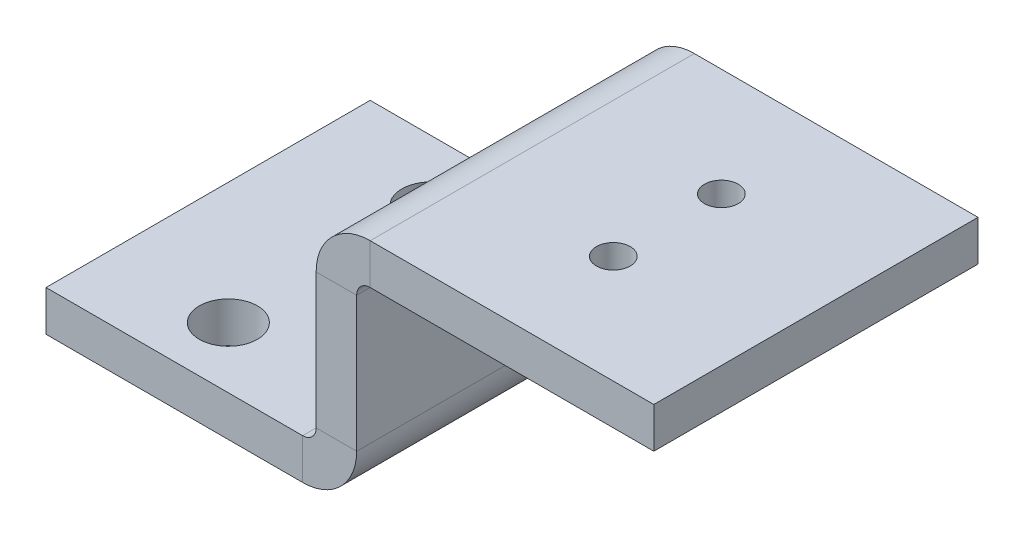
from build123d import *

# Parameters (mm, degrees)
SM_BASE_FLANGE_1_DEPTH = 24
HOLE_WIZARD_M4_1_D     = 4.3
M3X0_5_1_D             = 2.5


# Sheet-metal steps are written as plain solids
with BuildPart() as part:
    # Sketch 1 → 基材-凸緣1 (new body)
    with BuildSketch(Plane.XY):
        with BuildLine():
            Line((25, 15), (4, 15))
            ThreePointArc((4, 15), (1.171572875, 13.828427125), (0, 11))
            Line((0, 11), (0, 1))
            ThreePointArc((0, 1), (-0.292893219, 0.292893219), (-1, 0))
            Line((-1, 0), (-20, 0))
            Line((-20, 0), (-20, -3))
            Line((-20, -3), (-1, -3))
            ThreePointArc((-1, -3), (1.828427125, -1.828427125), (3, 1))
            Line((3, 1), (3, 11))
            ThreePointArc((3, 11), (3.292893219, 11.707106781), (4, 12))
            Line((4, 12), (25, 12))
            Line((25, 12), (25, 15))
        make_face()
    extrude(amount=SM_BASE_FLANGE_1_DEPTH)

    # M4 餘隙孔1 (through all)
    with Locations(Plane(origin=(0, 0, 0), x_dir=(1, 0, 0), z_dir=(0, 1, 0))):
        with Locations((-11, -19.5), (-11, -4.5)):
            Hole(HOLE_WIZARD_M4_1_D / 2)

    # M3x0.5 螺紋孔1 (through all)
    with Locations(Plane(origin=(0, 15, 0), x_dir=(1, 0, 0), z_dir=(0, 1, 0))):
        with Locations((14, -16), (14, -8)):
            Hole(M3X0_5_1_D / 2)


solid = part.part
